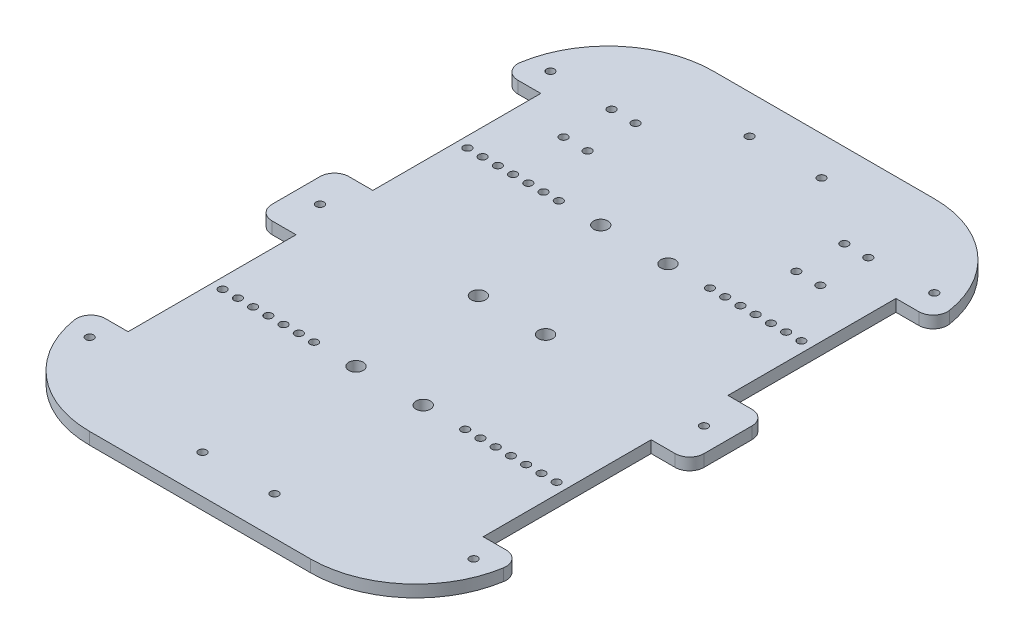
from build123d import *

# Parameters (mm, degrees)
BOSS_EXTRUDE4_DEPTH = 5
SKETCH5_R           = 1.65
SKETCH5_R_2         = 3
CUT_EXTRUDE1_DEPTH  = 159.192920196


with BuildPart() as part:
    # Sketch2 → Boss-Extrude4 (new body)
    with BuildSketch(Plane(origin=(0, 0, 0), x_dir=(1, 0, 0), z_dir=(0, 1, 0))):
        with BuildLine():
            Line((46, -130), (-46, -130))
            ThreePointArc((-46, -130), (-74.550970119, -119.478980051), (-89.448061775, -92.947368421))
            ThreePointArc((-89.448061775, -92.947368421), (-88.08864154, -88.106685893), (-83.523326079, -86))
            Line((-83.523326079, -86), (-74, -86))
            Line((-74, -86), (-74, -16))
            Line((-74, -16), (-84, -16))
            ThreePointArc((-84, -16), (-88.242640687, -14.242640687), (-90, -10))
            Line((-90, -10), (-90, 10))
            ThreePointArc((-90, 10), (-88.242640687, 14.242640687), (-84, 16))
            Line((-84, 16), (-74, 16))
            Line((-74, 16), (-74, 86))
            Line((-74, 86), (-83.523326079, 86))
            ThreePointArc((-83.523326079, 86), (-88.08864154, 88.106685893), (-89.448061775, 92.947368421))
            ThreePointArc((-89.448061775, 92.947368421), (-74.550970119, 119.478980051), (-46, 130))
            Line((-46, 130), (46, 130))
            ThreePointArc((46, 130), (74.550970119, 119.478980051), (89.448061775, 92.947368421))
            ThreePointArc((89.448061775, 92.947368421), (88.08864154, 88.106685893), (83.523326079, 86))
            Line((83.523326079, 86), (74, 86))
            Line((74, 86), (74, 16))
            Line((74, 16), (84, 16))
            ThreePointArc((84, 16), (88.242640687, 14.242640687), (90, 10))
            Line((90, 10), (90, -10))
            ThreePointArc((90, -10), (88.242640687, -14.242640687), (84, -16))
            Line((84, -16), (74, -16))
            Line((74, -16), (74, -86))
            Line((74, -86), (83.523326079, -86))
            ThreePointArc((83.523326079, -86), (88.08864154, -88.106685893), (89.448061775, -92.947368421))
            ThreePointArc((89.448061775, -92.947368421), (74.550970119, -119.478980051), (46, -130))
        make_face()
    extrude(amount=BOSS_EXTRUDE4_DEPTH)

    # Sketch5 → Cut-Extrude1 (cut, through all)
    with BuildSketch(Plane(origin=(0, 5, 0), x_dir=(1, 0, 0), z_dir=(0, 1, 0))):
        with Locations((-69.6, -51)):
            Circle(SKETCH5_R)
        with Locations((-63.25, -51)):
            Circle(SKETCH5_R)
        with Locations((-56.9, -51)):
            Circle(SKETCH5_R)
        with Locations((-50.55, -51)):
            Circle(SKETCH5_R)
        with Locations((-44.2, -51)):
            Circle(SKETCH5_R)
        with Locations((-37.85, -51)):
            Circle(SKETCH5_R)
        with Locations((-31.5, -51)):
            Circle(SKETCH5_R)
        with Locations((31.5, -51)):
            Circle(SKETCH5_R)
        with Locations((37.85, -51)):
            Circle(SKETCH5_R)
        with Locations((44.2, -51)):
            Circle(SKETCH5_R)
        with Locations((50.55, -51)):
            Circle(SKETCH5_R)
        with Locations((56.9, -51)):
            Circle(SKETCH5_R)
        with Locations((63.25, -51)):
            Circle(SKETCH5_R)
        with Locations((69.6, -51)):
            Circle(SKETCH5_R)
        with Locations((69.6, 51)):
            Circle(SKETCH5_R)
        with Locations((63.25, 51)):
            Circle(SKETCH5_R)
        with Locations((56.9, 51)):
            Circle(SKETCH5_R)
        with Locations((50.55, 51)):
            Circle(SKETCH5_R)
        with Locations((44.2, 51)):
            Circle(SKETCH5_R)
        with Locations((37.85, 51)):
            Circle(SKETCH5_R)
        with Locations((31.5, 51)):
            Circle(SKETCH5_R)
        with Locations((-31.5, 51)):
            Circle(SKETCH5_R)
        with Locations((-37.85, 51)):
            Circle(SKETCH5_R)
        with Locations((-44.2, 51)):
            Circle(SKETCH5_R)
        with Locations((-50.55, 51)):
            Circle(SKETCH5_R)
        with Locations((-56.9, 51)):
            Circle(SKETCH5_R)
        with Locations((-63.25, 51)):
            Circle(SKETCH5_R)
        with Locations((-69.6, 51)):
            Circle(SKETCH5_R)
        with Locations((-14, -51)):
            Circle(SKETCH5_R_2)
        with Locations((14, -51)):
            Circle(SKETCH5_R_2)
        with Locations((14, 51)):
            Circle(SKETCH5_R_2)
        with Locations((-14, 51)):
            Circle(SKETCH5_R_2)
        with Locations((-14, 0)):
            Circle(SKETCH5_R_2)
        with Locations((14, 0)):
            Circle(SKETCH5_R_2)
        with Locations((-80, 96)):
            Circle(SKETCH5_R)
        with Locations((-80, 0)):
            Circle(SKETCH5_R)
        with Locations((80, 0)):
            Circle(SKETCH5_R)
        with Locations((-80, -96)):
            Circle(SKETCH5_R)
        with Locations((80, -96)):
            Circle(SKETCH5_R)
        with Locations((80, 96)):
            Circle(SKETCH5_R)
        with Locations((-15, -114)):
            Circle(SKETCH5_R)
        with Locations((15, -114)):
            Circle(SKETCH5_R)
        with Locations((15, 114)):
            Circle(SKETCH5_R)
        with Locations((-15, 114)):
            Circle(SKETCH5_R)
        with Locations((-53.5, 95)):
            Circle(SKETCH5_R)
        with Locations((-53.5, 75)):
            Circle(SKETCH5_R)
        with Locations((-43.5, 75)):
            Circle(SKETCH5_R)
        with Locations((-43.5, 95)):
            Circle(SKETCH5_R)
        with Locations((43.5, 75)):
            Circle(SKETCH5_R)
        with Locations((53.5, 75)):
            Circle(SKETCH5_R)
        with Locations((43.5, 95)):
            Circle(SKETCH5_R)
        with Locations((53.5, 95)):
            Circle(SKETCH5_R)
    extrude(amount=-CUT_EXTRUDE1_DEPTH, mode=Mode.SUBTRACT)


solid = part.part
